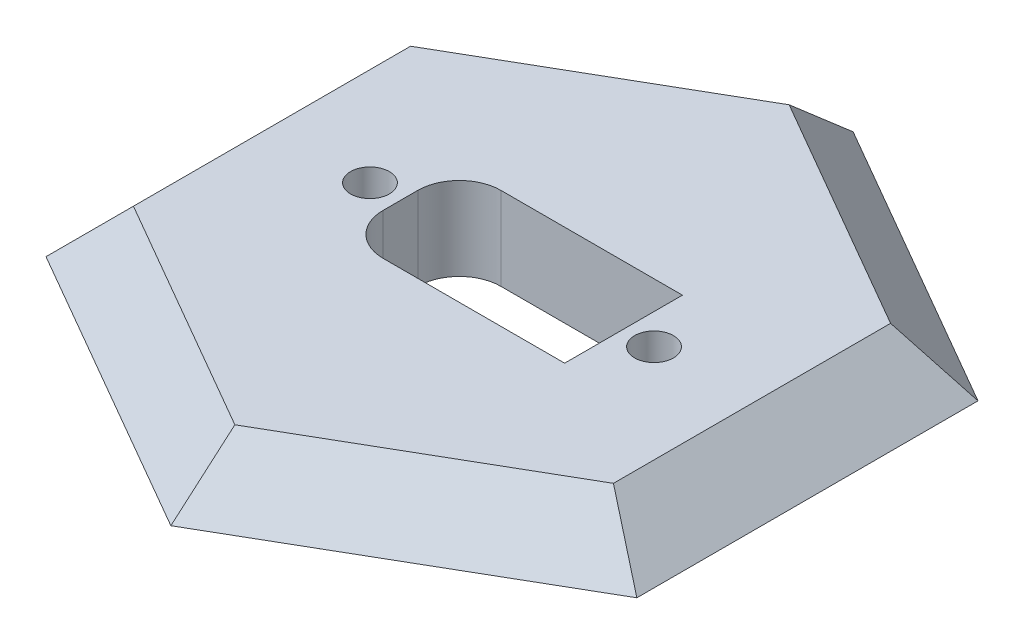
from build123d import *

# Parameters (mm, degrees)
SKETCH1_R           = 26
BOSS_EXTRUDE1_DEPTH = 4
SKETCH3_R           = 15
BOSS_EXTRUDE2_DEPTH = 2
CUT_EXTRUDE1_DEPTH  = 20
SKETCH4_R           = 1.4
CUT_EXTRUDE2_DEPTH  = 10
SKETCH6_OUTSIDE_W   = 88.756
SKETCH6_OUTSIDE_H   = 88.756
CUT_EXTRUDE3_DEPTH  = 10
CUT_EXTRUDE3_DRAFT  = -45


with BuildPart() as part:
    # Sketch1 → Boss-Extrude1 (new body)
    with BuildSketch(Plane(origin=(0, 0, 0), x_dir=(1, 0, 0), z_dir=(0, 1, 0))):
        Circle(SKETCH1_R)
    extrude(amount=BOSS_EXTRUDE1_DEPTH)

    # Sketch3 → Boss-Extrude2 (add)
    with BuildSketch(Plane.XZ):
        Circle(SKETCH3_R)
    extrude(amount=BOSS_EXTRUDE2_DEPTH)

    # Sketch2 → Cut-Extrude1 (cut)
    with BuildSketch(Plane(origin=(0, 4, 0), x_dir=(1, 0, 0), z_dir=(0, 1, 0))):
        with BuildLine():
            Line((-5.05, -4.25), (8.05, -4.25))
            Line((8.05, -4.25), (8.05, 4.25))
            Line((8.05, 4.25), (-5.05, 4.25))
            ThreePointArc((-5.05, 4.25), (-7.171320344, 3.371320344), (-8.05, 1.25))
            Line((-8.05, 1.25), (-8.05, -1.25))
            ThreePointArc((-8.05, -1.25), (-7.171320344, -3.371320344), (-5.05, -4.25))
        make_face()
    extrude(amount=-CUT_EXTRUDE1_DEPTH, mode=Mode.SUBTRACT)

    # Sketch4 → Cut-Extrude2 (cut)
    with BuildSketch(Plane(origin=(0, 4, 0), x_dir=(1, 0, 0), z_dir=(0, 1, 0))):
        with Locations((-10.25, 0)):
            Circle(SKETCH4_R)
        with Locations((10.25, 0)):
            Circle(SKETCH4_R)
    extrude(amount=-CUT_EXTRUDE2_DEPTH, mode=Mode.SUBTRACT)


with BuildPart() as cut_extrude3_tool:
    # Sketch6 outside → Cut-Extrude3 (with draft: the straight prism first)
    with BuildSketch(Plane(origin=(0, 4, 0), x_dir=(1, 0, 0), z_dir=(0, 1, 0))):
        Rectangle(SKETCH6_OUTSIDE_W, SKETCH6_OUTSIDE_H)
        Polygon((0, 20), (-17.320508076, 10), (-17.320508076, -10), (0, -20), (17.320508076, -10), (17.320508076, 10), align=None, mode=Mode.SUBTRACT)
    extrude(amount=-CUT_EXTRUDE3_DEPTH)
    # Cut-Extrude3: the draft: its side faces are tilted about the plane it starts from
    cut_extrude3_sides = [cut_extrude3_tool.faces().sort_by_distance(p)[0] for p in [
        (0, -1, 44.378),
        (44.378, -1, 0),
        (0, -1, -44.378),
        (-44.378, -1, 0),
        (8.660254038, -1, -15),
        (17.320508076, -1, 0),
        (8.660254038, -1, 15),
        (-8.660254038, -1, 15),
        (-17.320508076, -1, 0),
        (-8.660254038, -1, -15),
    ]]
    draft(cut_extrude3_sides, Plane(origin=(0, 4, 0), x_dir=(1, 0, 0), z_dir=(0, 1, 0)), CUT_EXTRUDE3_DRAFT)


with BuildPart() as part_1:
    add(part.part)

    # Cut-Extrude3: cut by cut_extrude3_tool
    add(cut_extrude3_tool.part, mode=Mode.SUBTRACT)


solid = part_1.part
